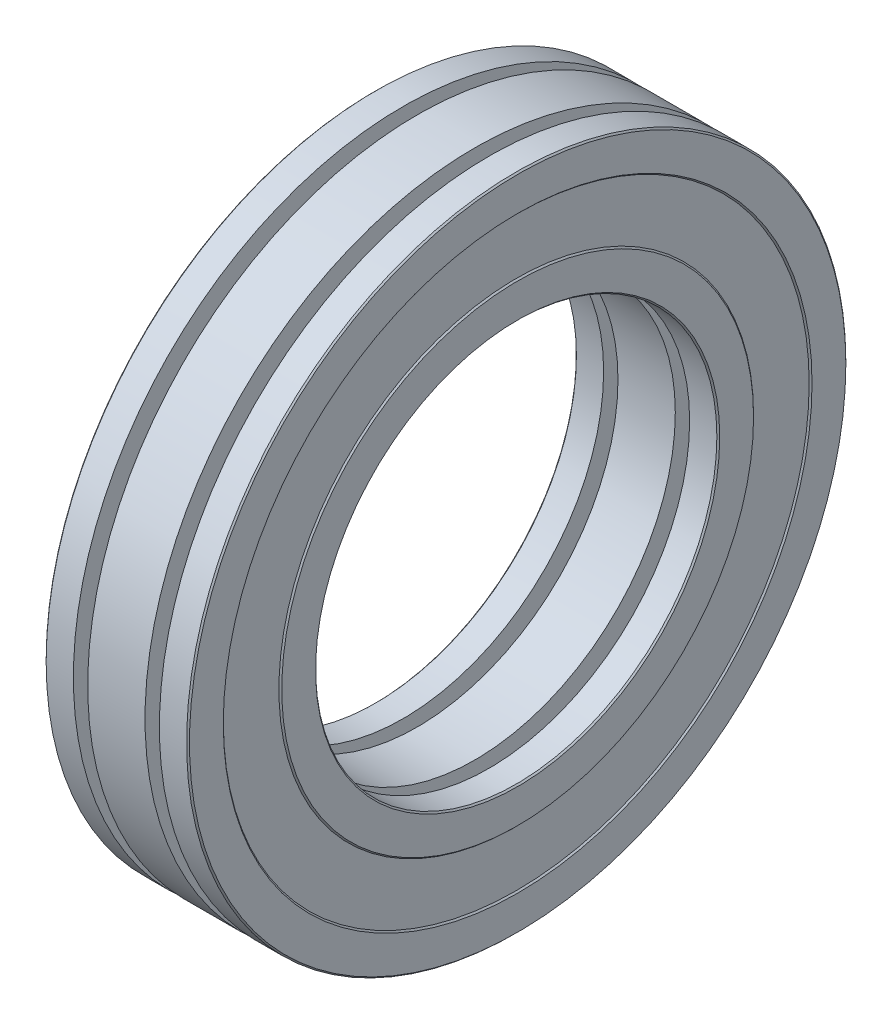
from build123d import *

# Parameters (mm, degrees)
SMUSSO1_SIZE = 0.05


with BuildPart() as part:
    # Schizzo1 → Rivoluzione1 (revolve)
    with BuildSketch(Plane.XY, mode=Mode.PRIVATE) as rivoluzione1_sk:
        Polygon((0.935183111, 7), (1.935183111, 7), (1.935183111, 7.8), (2.435183111, 7.8), (2.435183111, 7), (4.435183111, 7), (4.435183111, 7.8), (4.935183111, 7.8), (4.935183111, 7), (5.935183111, 7), (5.935183111, 8.280172414), (5.885183111, 8.280172414), (5.885183111, 10.219827586), (5.935183111, 10.219827586), (5.935183111, 11.5), (4.935183111, 11.5), (4.935183111, 10.7), (4.435183111, 10.7), (4.435183111, 11.5), (2.435183111, 11.5), (2.435183111, 10.7), (1.935183111, 10.7), (1.935183111, 11.5), (0.935183111, 11.5), (0.935183111, 10.219827586), (0.985183111, 10.219827586), (0.985183111, 8.280172414), (0.935183111, 8.280172414), align=None)
    revolve(rivoluzione1_sk.sketch.rotate(Axis((0, 0, 0), (-1, 0, 0)), 90), axis=Axis((0, 0, 0), (-1, 0, 0)))

    # Smusso1
    smusso1_edges = [part.edges().sort_by_distance(p)[0] for p in [
        (0.935183111, 0, 8.280172414),
        (0.935183111, 0, 10.219827586),
        (0.935183111, 0, 11.5),
        (5.935183111, 0, 11.5),
        (5.935183111, 0, 10.219827586),
        (5.935183111, 0, 8.280172414),
        (5.935183111, 0, 7),
        (0.935183111, 0, 7),
    ]]
    chamfer(smusso1_edges, length=SMUSSO1_SIZE - 0.0001)  # a hair under: the kernel refuses the full size


solid = part.part
